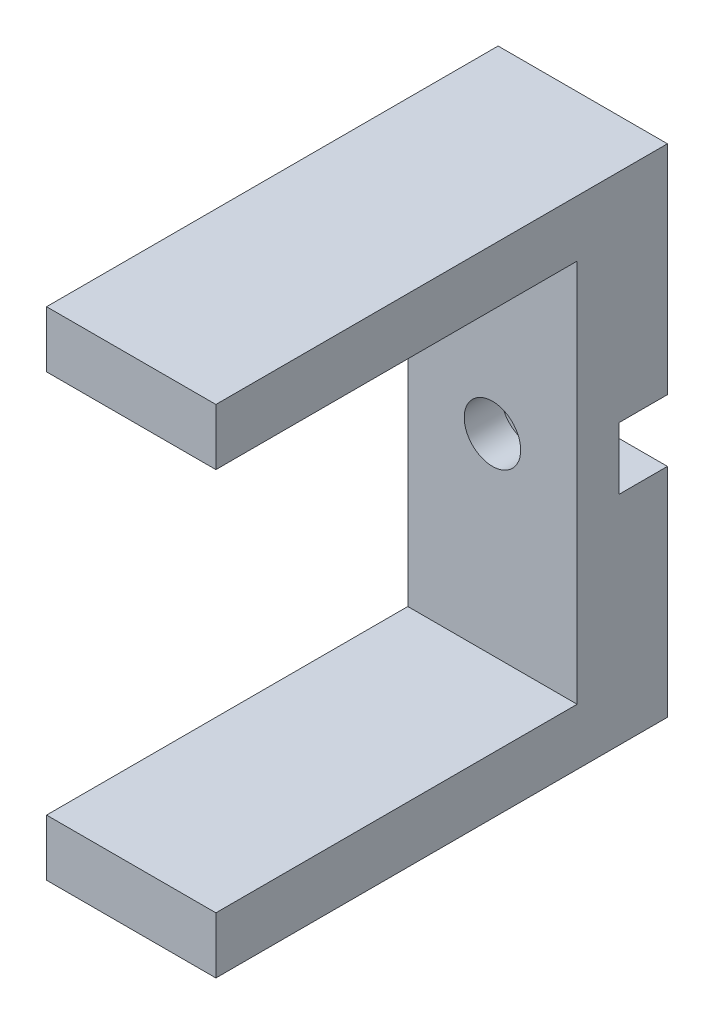
from build123d import *

# Parameters (mm, degrees)
SKETCH1_W          = 15
SKETCH1_H          = 44
EXTRUDE1_DEPTH     = 40
SKETCH2_W          = 15
SKETCH2_H          = 34
CUT_EXTRUDE1_DEPTH = 32
CUT_EXTRUDE2_DEPTH = 4.3
SKETCH4_R          = 1.25
CUT_EXTRUDE3_DEPTH = 4.3
SKETCH5_R          = 2.5
CUT_EXTRUDE4_DEPTH = 3.3


with BuildPart() as part:
    # Sketch1 → Extrude1 (new body)
    with BuildSketch(Plane.XY):
        with Locations((-19.74138299, 12.778040673)):
            Rectangle(SKETCH1_W, SKETCH1_H)
    extrude(amount=EXTRUDE1_DEPTH)

    # Sketch2 → Cut-Extrude1 (cut)
    with BuildSketch(Plane.XY.offset(40)):
        with Locations((-19.74138299, 12.778040673)):
            Rectangle(SKETCH2_W, SKETCH2_H)
    extrude(amount=-CUT_EXTRUDE1_DEPTH, mode=Mode.SUBTRACT)

    # Sketch3 → Cut-Extrude2 (cut)
    with BuildSketch(Plane(origin=(0, 0, 0), x_dir=(-1, 0, 0), z_dir=(0, 0, -1))):
        Polygon((22.49138299, 10.028040673), (27.24138299, 10.028040673), (27.24138299, 15.528040673), (22.49138299, 15.528040673), (22.49138299, 27.528040673), (16.99138299, 27.528040673), (16.99138299, 15.528040673), (12.24138299, 15.528040673), (12.24138299, 10.028040673), (16.99138299, 10.028040673), (16.99138299, -1.971959327), (22.49138299, -1.971959327), align=None)
    extrude(amount=-CUT_EXTRUDE2_DEPTH, mode=Mode.SUBTRACT)

    # Sketch4 → Cut-Extrude3 (cut)
    with BuildSketch(Plane(origin=(0, 0, 4.3), x_dir=(-1, 0, 0), z_dir=(0, 0, -1))):
        with Locations((19.74138299, 12.778040673)):
            Circle(SKETCH4_R)
    extrude(amount=-CUT_EXTRUDE3_DEPTH, mode=Mode.SUBTRACT)

    # Sketch5 → Cut-Extrude4 (cut)
    with BuildSketch(Plane.XY.offset(8)):
        with Locations((-19.74138299, 12.778040673)):
            Circle(SKETCH5_R)
    extrude(amount=-CUT_EXTRUDE4_DEPTH, mode=Mode.SUBTRACT)


solid = part.part
